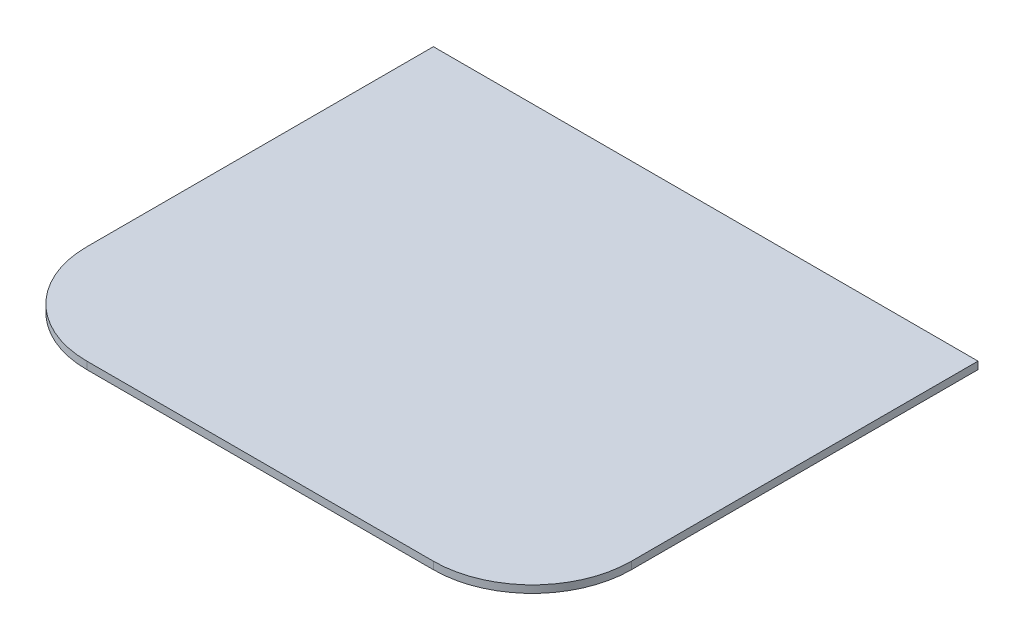
from build123d import *

# Parameters (mm, degrees)
SKETCH2_W           = 220
SKETCH2_H           = 180
BOSS_EXTRUDE1_DEPTH = 3
FILLET1_R           = 40


with BuildPart() as part:
    # Sketch2 → Boss-Extrude1 (new body)
    with BuildSketch(Plane(origin=(0, 0, 0), x_dir=(1, 0, 0), z_dir=(0, 1, 0))):
        Rectangle(SKETCH2_W, SKETCH2_H)
    extrude(amount=BOSS_EXTRUDE1_DEPTH)

    # Fillet1
    fillet1_edges = [part.edges().sort_by_distance(p)[0] for p in [
        (-110, 1.5, 90),
        (110, 1.5, 90),
    ]]
    fillet(fillet1_edges, radius=FILLET1_R)


solid = part.part
